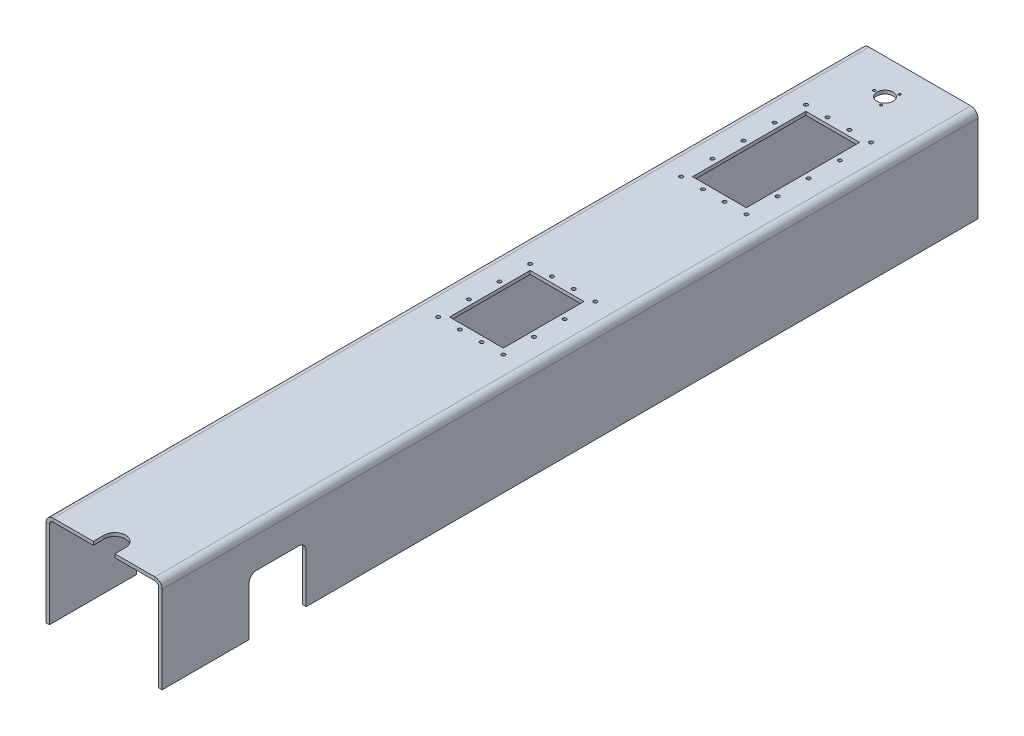
from build123d import *

# Parameters (mm, degrees)
FLANGE_BASE2_DEPTH         = 1517.3
ESBO_O10_R                 = 15
ESBO_O10_R_2               = 2.1
ESBO_O10_R_3               = 3.4
ESBO_O10_W                 = 100
ESBO_O10_H                 = 210.6
ESBO_O10_H_2               = 150
CORTE_EXTRUS_O1_DEPTH      = 1532.196117452
CORTE_EXTRUS_O2_DEPTH      = 1543.569660534
CORTE_EXTRUS_O2_DEPTH_BACK = 1543.569660534
CORTE_EXTRUS_O3_DEPTH      = 1543.569660534
CORTE_EXTRUS_O3_DEPTH_BACK = 10
ESBO_O12_R                 = 15


# Sheet-metal steps are written as plain solids
with BuildPart() as part:
    # Esboço1 → Flange-base2 (new body)
    with BuildSketch(Plane.XY):
        with BuildLine():
            Line((-107.95, -175.24), (-107.95, -13.35))
            ThreePointArc((-107.95, -13.35), (-104.039875529, -3.910124471), (-94.6, 0))
            Line((-94.6, 0), (94.6, 0))
            ThreePointArc((94.6, 0), (104.039875529, -3.910124471), (107.95, -13.35))
            Line((107.95, -13.35), (107.95, -175.24))
            Line((107.95, -175.24), (101.6, -175.24))
            Line((101.6, -175.24), (101.6, -13.35))
            ThreePointArc((101.6, -13.35), (99.549747468, -8.400252532), (94.6, -6.35))
            Line((94.6, -6.35), (-94.6, -6.35))
            ThreePointArc((-94.6, -6.35), (-99.549747468, -8.400252532), (-101.6, -13.35))
            Line((-101.6, -13.35), (-101.6, -175.24))
            Line((-101.6, -175.24), (-107.95, -175.24))
        make_face()
    extrude(amount=-FLANGE_BASE2_DEPTH)

    # Esboço10 → Corte-extrusão1 (cut, through all)
    with BuildSketch(Plane(origin=(0, 0, 0), x_dir=(1, 0, 0), z_dir=(0, 1, 0))):
        with Locations(Location((0, 1452.3, 0), (0, 0, 270))):
            Circle(ESBO_O10_R)
        with Locations(Location((-20, 1452.3, 0), (0, 0, 270))):
            Circle(ESBO_O10_R_2)
        with Locations(Location((10, 1469.620508076, 0), (0, 0, 270))):
            Circle(ESBO_O10_R_2)
        with Locations(Location((10, 1434.979491924, 0), (0, 0, 270))):
            Circle(ESBO_O10_R_2)
        with Locations(Location((-60.6, 1365.7, 0), (0, 0, 270))):
            Circle(ESBO_O10_R_3)
        with Locations(Location((60.6, 1365.7, 0), (0, 0, 270))):
            Circle(ESBO_O10_R_3)
        with Locations(Location((60.6, 1133.9, 0), (0, 0, 270))):
            Circle(ESBO_O10_R_3)
        with Locations(Location((-60.6, 1133.9, 0), (0, 0, 270))):
            Circle(ESBO_O10_R_3)
        with Locations(Location((-20.2, 1365.7, 0), (0, 0, 270))):
            Circle(ESBO_O10_R_3)
        with Locations(Location((20.2, 1365.7, 0), (0, 0, 270))):
            Circle(ESBO_O10_R_3)
        with Locations(Location((-60.6, 1191.85, 0), (0, 0, 270))):
            Circle(ESBO_O10_R_3)
        with Locations(Location((-60.6, 1249.8, 0), (0, 0, 270))):
            Circle(ESBO_O10_R_3)
        with Locations(Location((-60.6, 1307.75, 0), (0, 0, 270))):
            Circle(ESBO_O10_R_3)
        with Locations(Location((20.2, 1133.9, 0), (0, 0, 270))):
            Circle(ESBO_O10_R_3)
        with Locations(Location((-20.2, 1133.9, 0), (0, 0, 270))):
            Circle(ESBO_O10_R_3)
        with Locations(Location((60.6, 1191.85, 0), (0, 0, 270))):
            Circle(ESBO_O10_R_3)
        with Locations(Location((60.6, 1249.8, 0), (0, 0, 270))):
            Circle(ESBO_O10_R_3)
        with Locations(Location((60.6, 1307.75, 0), (0, 0, 270))):
            Circle(ESBO_O10_R_3)
        with Locations(Location((-60.6, 853.1, 0), (0, 0, 270))):
            Circle(ESBO_O10_R_3)
        with Locations(Location((60.6, 853.1, 0), (0, 0, 270))):
            Circle(ESBO_O10_R_3)
        with Locations(Location((60.6, 681.9, 0), (0, 0, 270))):
            Circle(ESBO_O10_R_3)
        with Locations(Location((-60.6, 681.9, 0), (0, 0, 270))):
            Circle(ESBO_O10_R_3)
        with Locations(Location((-20.2, 853.1, 0), (0, 0, 270))):
            Circle(ESBO_O10_R_3)
        with Locations(Location((20.2, 853.1, 0), (0, 0, 270))):
            Circle(ESBO_O10_R_3)
        with Locations(Location((-60.6, 738.966666667, 0), (0, 0, 270))):
            Circle(ESBO_O10_R_3)
        with Locations(Location((-60.6, 796.033333333, 0), (0, 0, 270))):
            Circle(ESBO_O10_R_3)
        with Locations(Location((20.2, 681.9, 0), (0, 0, 270))):
            Circle(ESBO_O10_R_3)
        with Locations(Location((-20.2, 681.9, 0), (0, 0, 270))):
            Circle(ESBO_O10_R_3)
        with Locations(Location((60.6, 738.966666667, 0), (0, 0, 270))):
            Circle(ESBO_O10_R_3)
        with Locations(Location((60.6, 796.033333333, 0), (0, 0, 270))):
            Circle(ESBO_O10_R_3)
        with Locations((0, 1249.8)):
            Rectangle(ESBO_O10_W, ESBO_O10_H)
        with Locations((0, 767.5)):
            Rectangle(ESBO_O10_W, ESBO_O10_H_2)
        with BuildLine():
            Line((-20, 20), (-20, 0))
            Line((-20, 0), (20, 0))
            Line((20, 0), (20, 20))
            ThreePointArc((20, 20), (0, 40), (-20, 20))
        make_face()
    extrude(amount=-CORTE_EXTRUS_O1_DEPTH, mode=Mode.SUBTRACT)

    # Esboço11 → Corte-extrusão2 (cut, two sides: drawn at the far end of the back side and taken through both)
    with BuildSketch(Plane(origin=(107.95, 0, 0), x_dir=(0, 0, -1), z_dir=(1, 0, 0)).offset(-CORTE_EXTRUS_O2_DEPTH_BACK)):
        with BuildLine():
            Line((161.89, -175.24), (267.89, -175.24))
            Line((267.89, -175.24), (267.89, -84.54))
            ThreePointArc((267.89, -84.54), (263.789494937, -74.640505063), (253.89, -70.54))
            Line((253.89, -70.54), (175.89, -70.54))
            ThreePointArc((175.89, -70.54), (165.990505063, -74.640505063), (161.89, -84.54))
            Line((161.89, -84.54), (161.89, -175.24))
        make_face()
    extrude(amount=CORTE_EXTRUS_O2_DEPTH + CORTE_EXTRUS_O2_DEPTH_BACK, mode=Mode.SUBTRACT)

    # Esboço12 → Corte-extrusão3 (cut, two sides: drawn at the far end of the back side and taken through both)
    with BuildSketch(Plane.ZY.offset(107.95).offset(-CORTE_EXTRUS_O3_DEPTH_BACK)):
        with Locations(Location((-1239.9, -128.76, 0), (0, 0, 90))):
            Circle(ESBO_O12_R)
        with Locations(Location((-691.9, -45.24, 0), (0, 0, 90))):
            Circle(ESBO_O12_R)
    extrude(amount=CORTE_EXTRUS_O3_DEPTH + CORTE_EXTRUS_O3_DEPTH_BACK, mode=Mode.SUBTRACT)


solid = part.part
